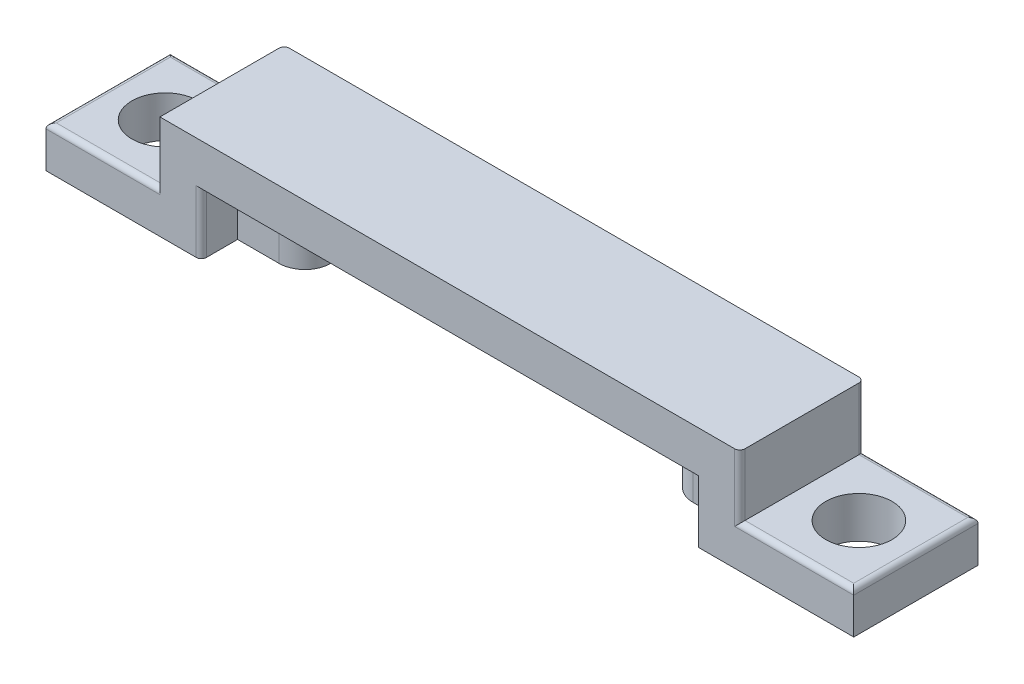
from build123d import *

# Parameters (mm, degrees)
AUFSATZ_LINEAR_AUSTRAGEN1_DEPTH = 6
SKIZZE4_R                       = 1.6
SCHNITT_LINEAR_AUSTRAGEN1_DEPTH = 3
AUFSATZ_LINEAR_AUSTRAGEN2_DEPTH = 3
VERRUNDUNG1_R                   = 0.25


with BuildPart() as part:
    # Skizze1 → Aufsatz-Linear austragen1 (new body)
    with BuildSketch(Plane.XY):
        Polygon((0, 0), (7.5, 0), (7.5, 3), (31.5, 3), (31.5, 0), (39, 0), (39, 2), (33.5, 2), (33.5, 5), (5.5, 5), (5.5, 2), (0, 2), align=None)
    extrude(amount=AUFSATZ_LINEAR_AUSTRAGEN1_DEPTH)

    # Skizze4 → Schnitt-Linear austragen1 (cut)
    with BuildSketch(Plane.XZ):
        with Locations((36.25, 3)):
            Circle(SKIZZE4_R)
    schnitt_linear_austragen1 = extrude(amount=-SCHNITT_LINEAR_AUSTRAGEN1_DEPTH, mode=Mode.SUBTRACT)

    # Skizze12 → Aufsatz-Linear austragen2 (add)
    with BuildSketch(Plane.XZ.offset(-3)):
        with BuildLine():
            Line((31.5, 1.75), (29.5, 1.75))
            ThreePointArc((29.5, 1.75), (28.25, 3), (29.5, 4.25))
            Line((29.5, 4.25), (31.5, 4.25))
            Line((31.5, 4.25), (31.5, 1.75))
        make_face()
    aufsatz_linear_austragen2 = extrude(amount=AUFSATZ_LINEAR_AUSTRAGEN2_DEPTH)

    # Spiegeln3: Aufsatz-Linear austragen2 across plane
    add(aufsatz_linear_austragen2.mirror(Plane.ZY.offset(-19.5)))

    # Spiegeln4: Schnitt-Linear austragen1 across plane
    add(schnitt_linear_austragen1.mirror(Plane.ZY.offset(-19.5)), mode=Mode.SUBTRACT)

    # Verrundung1
    verrundung1_edges = [part.edges().sort_by_distance(p)[0] for p in [
        (7.5, 1.5, 6),
        (33.5, 3.5, 6),
        (33.5, 3.5, 0),
        (5.5, 3.5, 0),
        (2.75, 2, 6),
        (0, 2, 3),
        (2.75, 2, 0),
        (36.25, 2, 0),
        (39, 2, 3),
        (36.25, 2, 6),
    ]]
    fillet(verrundung1_edges, radius=VERRUNDUNG1_R)


solid = part.part
